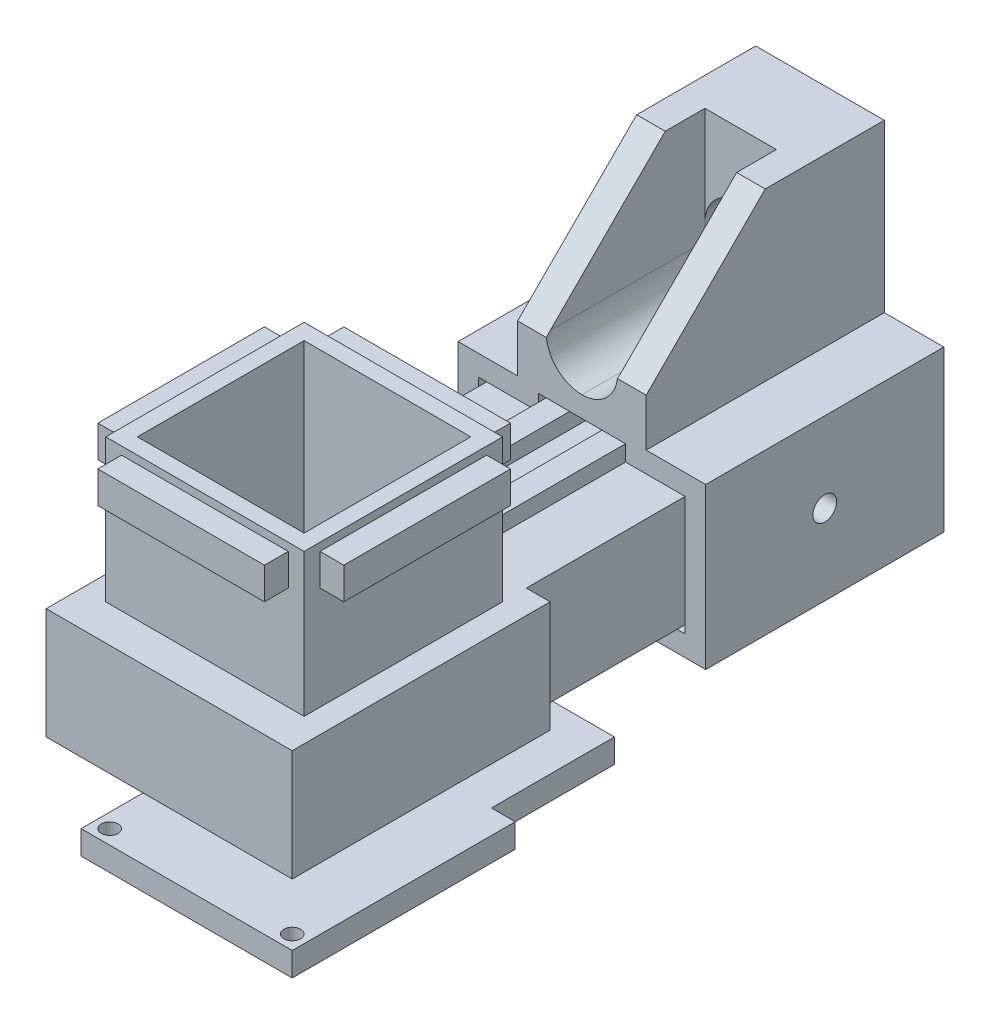
from build123d import *

# Parameters (mm, degrees)
SKETCH2_W            = 25
SKETCH2_H            = 25
SKETCH2_W_2          = 21
SKETCH2_H_2          = 21
BOSS_EXTRUDE1_DEPTH  = 25
BOSS_EXTRUDE2_START  = -1
SKETCH2_3_W          = 31
SKETCH2_3_H          = 31
SKETCH2_3_W_2        = 25
SKETCH2_3_H_2        = 25
BOSS_EXTRUDE2_DEPTH  = 4
SKETCH3_W            = 21
SKETCH3_H            = 21
BOSS_EXTRUDE4_DEPTH  = 7
CUT_EXTRUDE2_DEPTH   = 6
SKETCH3_12_W         = 21
SKETCH3_12_H         = 58
BOSS_EXTRUDE5_DEPTH  = 4
SKETCH3_16_W         = 10.5
SKETCH3_16_H         = 2
SKETCH3_16_H_2       = 2.5
CUT_EXTRUDE12_DEPTH  = 1
SKETCH6_W            = 1
SKETCH6_H            = 4
BOSS_EXTRUDE7_DEPTH  = 6
BOSS_EXTRUDE8_DEPTH  = 3
SKETCH7_R            = 1.05
CUT_EXTRUDE9_DEPTH   = 3
CUT_EXTRUDE11_DEPTH  = 3
SKETCH10_W           = 2
SKETCH10_H           = 9
BOSS_EXTRUDE12_DEPTH = 4
SKETCH8_R            = 1.05
BOSS_EXTRUDE9_DEPTH  = 3
SKETCH9_W            = 15
SKETCH9_H            = 6
CUT_EXTRUDE10_DEPTH  = 2
SKETCH11_W           = 3
SKETCH11_H           = 3
SKETCH11_W_2         = 2
SKETCH11_H_2         = 2
CUT_EXTRUDE13_DEPTH  = 4
SKETCH12_W           = 2.959272996
SKETCH12_H           = 2
BOSS_EXTRUDE13_DEPTH = 29.5
BOSS_EXTRUDE14_DEPTH = 30
SKETCH14_W           = 16.2
SKETCH14_H           = 19
BOSS_EXTRUDE16_DEPTH = 10
SKETCH14_5_R         = 1.1
CUT_EXTRUDE14_DEPTH  = 3
SKETCH14_7_R         = 2.6
CUT_EXTRUDE15_DEPTH  = 10
CUT_EXTRUDE16_START  = -10
SKETCH14_8_R         = 4.5
CUT_EXTRUDE16_DEPTH  = 6
BOSS_EXTRUDE18_DEPTH = 20
CHAMFER1_SIZE        = 15
FILLET1_R            = 4.5
SKETCH19_R           = 1.5
CUT_EXTRUDE17_DEPTH  = 35


with BuildPart() as part:
    # Sketch2 → Boss-Extrude1 (new body)
    with BuildSketch(Plane(origin=(0, 0, 0), x_dir=(1, 0, 0), z_dir=(0, 1, 0))):
        Rectangle(SKETCH2_W, SKETCH2_H)
        Rectangle(SKETCH2_W_2, SKETCH2_H_2, mode=Mode.SUBTRACT)
    extrude(amount=-BOSS_EXTRUDE1_DEPTH)

    # Sketch2<3> → Boss-Extrude2 (add)
    with BuildSketch(Plane(origin=(0, 0, 0), x_dir=(1, 0, 0), z_dir=(0, 1, 0)).offset(BOSS_EXTRUDE2_START)):
        Rectangle(SKETCH2_3_W, SKETCH2_3_H)
        Rectangle(SKETCH2_3_W_2, SKETCH2_3_H_2, mode=Mode.SUBTRACT)
    extrude(amount=-BOSS_EXTRUDE2_DEPTH)

    # Sketch3 → Boss-Extrude4 (add)
    with BuildSketch(Plane.XZ.offset(25)):
        Polygon((-15.5, -15.5), (-12.5, -15.5), (-12.5, -45), (12.5, -45), (12.5, -15.5), (15.5, -15.5), (15.5, 17), (-15.5, 17), align=None)
        Rectangle(SKETCH3_W, SKETCH3_H, mode=Mode.SUBTRACT)
    extrude(amount=-BOSS_EXTRUDE4_DEPTH)

    # Sketch3<7> → Cut-Extrude2 (cut)
    with BuildSketch(Plane.XZ.offset(25)):
        with BuildLine():
            Line((-1.5, -10.83772234), (-1.5, -9.748010995))
            Line((-1.5, -9.748010995), (1.5, -9.748010995))
            Line((1.5, -9.748010995), (1.5, -10.83772234))
            ThreePointArc((1.5, -10.83772234), (3.5, -14), (1.5, -17.16227766))
            Line((1.5, -17.16227766), (1.5, -18.251989005))
            Line((1.5, -18.251989005), (-1.5, -18.251989005))
            Line((-1.5, -18.251989005), (-1.5, -17.16227766))
            ThreePointArc((-1.5, -17.16227766), (-3.5, -14), (-1.5, -10.83772234))
        make_face()
    extrude(amount=-CUT_EXTRUDE2_DEPTH, mode=Mode.SUBTRACT)

    # Sketch3<12> → Boss-Extrude5 (add)
    with BuildSketch(Plane.XZ.offset(25)):
        Polygon((-12.5, -15.5), (-12.5, -45), (12.5, -45), (12.5, -15.5), (15.5, -15.5), (15.5, 17), (-15.5, 17), (-15.5, -15.5), align=None)
        with Locations((0, -14)):
            Rectangle(SKETCH3_12_W, SKETCH3_12_H, mode=Mode.SUBTRACT)
    extrude(amount=BOSS_EXTRUDE5_DEPTH)

    # Sketch3<16> → Cut-Extrude12 (cut)
    with BuildSketch(Plane.XZ.offset(25)):
        with Locations((-5.25, 11.5)):
            Rectangle(SKETCH3_16_W, SKETCH3_16_H)
        with Locations((-5.25, 13.75)):
            Rectangle(SKETCH3_16_W, SKETCH3_16_H_2)
    extrude(amount=-CUT_EXTRUDE12_DEPTH, mode=Mode.SUBTRACT)

    # Sketch6 → Boss-Extrude7 (add)
    with BuildSketch(Plane.XZ.offset(29)):
        with Locations((10, 13)):
            Rectangle(SKETCH6_W, SKETCH6_H)
        with Locations((-10, 13)):
            Rectangle(SKETCH6_W, SKETCH6_H)
    extrude(amount=-BOSS_EXTRUDE7_DEPTH)

    # Sketch6<3> → Boss-Extrude8 (add)
    with BuildSketch(Plane.XZ.offset(29)):
        Polygon((15.5, -15.5), (15.5, 17), (-15.5, 17), (-15.5, -15.5), (-12.5, -15.5), (-12.5, -45), (12.5, -45), (12.5, -15.5), align=None)
        Polygon((10.5, 15), (13.5, 15), (13.5, 11), (13.5, -13.5), (10.5, -13.5), (10.5, -43), (-10.5, -43), (-10.5, -13.5), (-13.5, -13.5), (-13.5, 11), (-13.5, 15), (-10.5, 15), (-9.5, 15), (9.5, 15), align=None, mode=Mode.SUBTRACT)
    extrude(amount=BOSS_EXTRUDE8_DEPTH)

    # Sketch7 → Cut-Extrude9 (cut)
    with BuildSketch(Plane.XZ.offset(29)):
        with Locations(Location((-11.5, 13, 0), (0, 0, 270))):
            Circle(SKETCH7_R)
        with Locations(Location((11.5, 13, 0), (0, 0, 270))):
            Circle(SKETCH7_R)
    extrude(amount=-CUT_EXTRUDE9_DEPTH, mode=Mode.SUBTRACT)

    # Sketch3<14> → Cut-Extrude11 (cut)
    with BuildSketch(Plane.XZ.offset(25)):
        Polygon((-1.5, -17.5), (-10.5, -17.5), (-10.5, -34), (-3.5, -34), (-3.5, -41), (10.5, -41), (10.5, -17.5), (1.5, -17.5), (1.5, -18.251989005), (-1.5, -18.251989005), align=None)
    extrude(amount=-CUT_EXTRUDE11_DEPTH, mode=Mode.SUBTRACT)

    # Sketch10 → Boss-Extrude12 (add)
    with BuildSketch(Plane.XZ.offset(25)):
        with Locations((-9.5, -38.5)):
            Rectangle(SKETCH10_W, SKETCH10_H)
    extrude(amount=BOSS_EXTRUDE12_DEPTH)

    # Sketch9 → Cut-Extrude10 (cut)
    with BuildSketch(Plane(origin=(0, 0, -45), x_dir=(-1, 0, 0), z_dir=(0, 0, -1))):
        with Locations((-1, -29)):
            Rectangle(SKETCH9_W, SKETCH9_H)
    extrude(amount=-CUT_EXTRUDE10_DEPTH, mode=Mode.SUBTRACT)

    # Sketch11 → Cut-Extrude13 (cut)
    with BuildSketch(Plane(origin=(0, -1, 0), x_dir=(1, 0, 0), z_dir=(0, 1, 0))):
        with Locations((-14, -14)):
            Rectangle(SKETCH11_W, SKETCH11_H)
        with Locations((-11.5, -14)):
            Rectangle(SKETCH11_W_2, SKETCH11_H)
        with Locations((-14, -11.5)):
            Rectangle(SKETCH11_W, SKETCH11_H_2)
        with Locations((11.5, -14)):
            Rectangle(SKETCH11_W_2, SKETCH11_H)
        with Locations((14, -14)):
            Rectangle(SKETCH11_W, SKETCH11_H)
        with Locations((14, -11.5)):
            Rectangle(SKETCH11_W, SKETCH11_H_2)
        with Locations((-14, 11.5)):
            Rectangle(SKETCH11_W, SKETCH11_H_2)
        with Locations((-14, 14)):
            Rectangle(SKETCH11_W, SKETCH11_H)
        with Locations((-11.5, 14)):
            Rectangle(SKETCH11_W_2, SKETCH11_H)
        with Locations((11.5, 14)):
            Rectangle(SKETCH11_W_2, SKETCH11_H)
        with Locations((14, 14)):
            Rectangle(SKETCH11_W, SKETCH11_H)
        with Locations((14, 11.5)):
            Rectangle(SKETCH11_W, SKETCH11_H_2)
    extrude(amount=-CUT_EXTRUDE13_DEPTH, mode=Mode.SUBTRACT)

    # Sketch12 → Boss-Extrude13 (add)
    with BuildSketch(Plane(origin=(0, 0, -45), x_dir=(-1, 0, 0), z_dir=(0, 0, -1))):
        with Locations((-3.520363502, -17)):
            Rectangle(SKETCH12_W, SKETCH12_H)
        with Locations((3.520363502, -17)):
            Rectangle(SKETCH12_W, SKETCH12_H)
    extrude(amount=-BOSS_EXTRUDE13_DEPTH)


with BuildPart() as body_2:
    # Sketch8 → Boss-Extrude9 (new body)
    with BuildSketch(Plane(origin=(0, -42, 0), x_dir=(-1, 0, 0), z_dir=(0, -1, 0))):
        Polygon((-13.3, 13.3), (-13.3, -14.8), (13.3, -14.8), (13.3, 13.3), (10.3, 13.3), (10.3, 42.8), (6.8, 42.8), (6.8, 28.8), (-10.3, 28.8), (-10.3, 13.3), align=None)
        with Locations(Location((-11.5, -13, 0), (0, 0, 90))):
            Circle(SKETCH8_R, mode=Mode.SUBTRACT)
        with Locations(Location((11.5, -13, 0), (0, 0, 90))):
            Circle(SKETCH8_R, mode=Mode.SUBTRACT)
    extrude(amount=BOSS_EXTRUDE9_DEPTH)


with BuildPart() as body_3:
    # Sketch13 → Boss-Extrude14 (new body)
    with BuildSketch(Plane(origin=(0, 0, -65), x_dir=(-1, 0, 0), z_dir=(0, 0, -1))):
        Polygon((-8.5, -35.1), (6.5, -35.1), (15.6, -35.1), (15.6, -14.9), (8.1, -14.9), (8.1, -12.9), (0, -12.9), (-8.1, -12.9), (-8.1, -14.9), (-15.6, -14.9), (-15.6, -35.1), align=None)
        Polygon((13, -32.5), (6.5, -32.5), (-8.5, -32.5), (-13, -32.5), (-13, -17.5), (-5.5, -17.5), (-5.5, -15.5), (1.540727004, -15.5), (5.5, -15.5), (5.5, -17.5), (13, -17.5), align=None, mode=Mode.SUBTRACT)
    extrude(amount=-BOSS_EXTRUDE14_DEPTH)

    # Sketch14 → Boss-Extrude16 (add)
    with BuildSketch(Plane(origin=(0, 0, -65), x_dir=(-1, 0, 0), z_dir=(0, 0, -1))):
        with Locations((0, -3.4)):
            Rectangle(SKETCH14_W, SKETCH14_H)
    extrude(amount=-BOSS_EXTRUDE16_DEPTH)

    # Sketch14<5> → Cut-Extrude14 (cut)
    with BuildSketch(Plane(origin=(0, 0, -65), x_dir=(-1, 0, 0), z_dir=(0, 0, -1))):
        with Locations((4.5, -6.4)):
            Circle(SKETCH14_5_R)
        with Locations((-4.5, -6.4)):
            Circle(SKETCH14_5_R)
    extrude(amount=-CUT_EXTRUDE14_DEPTH, mode=Mode.SUBTRACT)

    # Sketch14<7> → Cut-Extrude15 (cut)
    with BuildSketch(Plane(origin=(0, 0, -65), x_dir=(-1, 0, 0), z_dir=(0, 0, -1))):
        with Locations((0, -6.4)):
            Circle(SKETCH14_7_R)
    extrude(amount=-CUT_EXTRUDE15_DEPTH, mode=Mode.SUBTRACT)

    # Sketch14<8> → Cut-Extrude16 (cut)
    with BuildSketch(Plane(origin=(0, 0, -65), x_dir=(-1, 0, 0), z_dir=(0, 0, -1)).offset(CUT_EXTRUDE16_START)):
        with Locations(Location((0, -6.4, 0), (0, 0, 180))):
            Circle(SKETCH14_8_R)
    extrude(amount=CUT_EXTRUDE16_DEPTH, mode=Mode.SUBTRACT)

    # Sketch18 → Boss-Extrude18 (add)
    with BuildSketch(Plane.XY.offset(-55)):
        Polygon((-8.1, 6.1), (-8.1, -12.9), (-4.5, -12.9), (-4.5, -6.4), (-4.5, 6.1), align=None)
        Polygon((4.5, -6.4), (4.5, -12.9), (8.1, -12.9), (8.1, 6.1), (4.5, 6.1), align=None)
    extrude(amount=BOSS_EXTRUDE18_DEPTH)

    # Chamfer1
    chamfer1_edges = [body_3.edges().sort_by_distance(p)[0] for p in [
        (6.3, 6.1, -35),
        (-6.3, 6.1, -35),
    ]]
    chamfer(chamfer1_edges, length=CHAMFER1_SIZE)

    # Fillet1
    fillet1_edges = [body_3.edges().sort_by_distance(p)[0] for p in [
        (4.5, -12.9, -45),
        (-4.5, -12.9, -45),
    ]]
    fillet(fillet1_edges, radius=FILLET1_R - 0.0001)  # a hair under: the kernel refuses the full size

    # Sketch19 → Cut-Extrude17 (cut)
    with BuildSketch(Plane(origin=(15.6, 0, 0), x_dir=(0, 0, -1), z_dir=(1, 0, 0))):
        with Locations(Location((50, -25, 0), (0, 0, 90))):
            Circle(SKETCH19_R)
    extrude(amount=-CUT_EXTRUDE17_DEPTH, mode=Mode.SUBTRACT)


solid = Compound([part.part, body_2.part, body_3.part])
